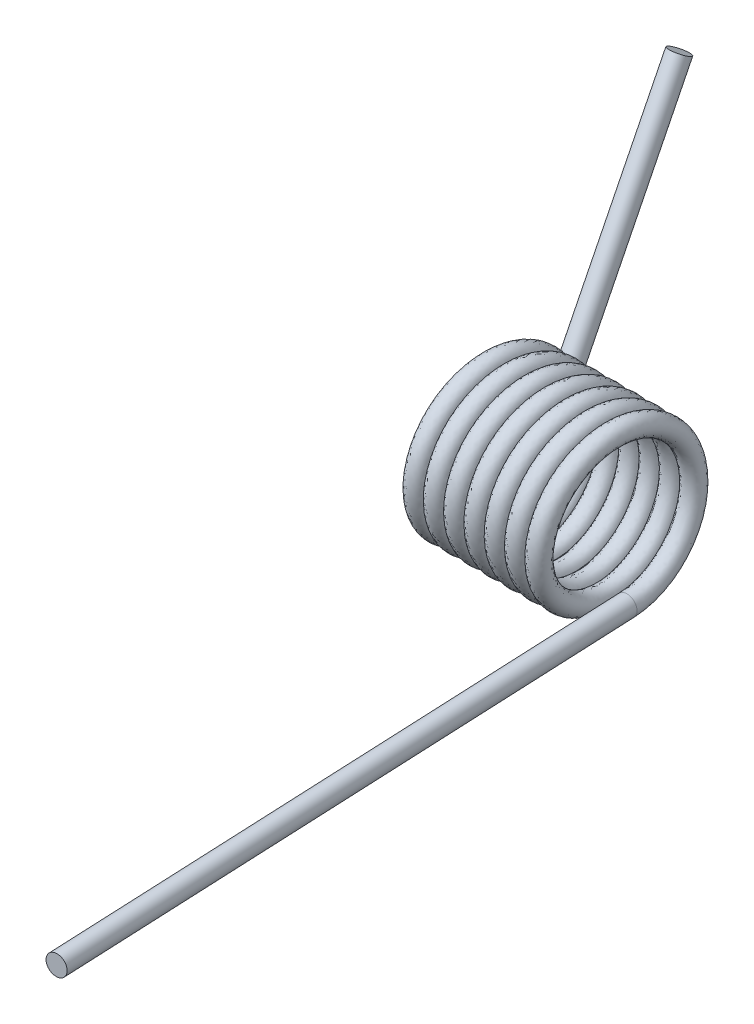
from build123d import *

# Parameters (mm, degrees)
SWEEP1_PITCH   = 3.4544
SKETCH4_R      = 1.7145
EXTRUDE1_DEPTH = 101.6
SKETCH5_R      = 1.7145
EXTRUDE2_DEPTH = 50.8


with BuildPart() as part:
    # Sweep1: the profile of Sketch3 screwed along a left-hand helix of 7.166667 turns, 6 arcs to a turn; built about Z, then put on its axis
    sweep1_z = Axis((0, 0, 0), (0, 0, 1))
    sweep1_corners = [(12.320738343, -0.07665633, -1.712322097), (13.994937093, 0.001781677, 0.039798483), (12.241061657, 0.07665633, 1.712322097), (10.566862907, -0.001781677, -0.039798483)]
    with BuildLine(mode=Mode.PRIVATE) as sweep1_profile:
        ThreePointArc((12.320738343, -0.07665633, -1.712322097), (13.521077214, -0.052944375, -1.182652789), (13.994937093, 0.001781677, 0.039798483))
        ThreePointArc((13.994937093, 0.001781677, 0.039798483), (13.464737289, 0.055464047, 1.238936343), (12.241061657, 0.07665633, 1.712322097))
        ThreePointArc((12.241061657, 0.07665633, 1.712322097), (11.040722786, 0.052944375, 1.182652789), (10.566862907, -0.001781677, -0.039798483))
        ThreePointArc((10.566862907, -0.001781677, -0.039798483), (11.097062711, -0.055464047, -1.238936343), (12.320738343, -0.07665633, -1.712322097))
    sweep1_cap = Face(sweep1_profile.wire())
    sweep1_arcs = [((12.320738343, -0.07665633, -1.712322097), (14.034775436, -0.074874653, -1.672523614), (13.994937093, 0.001781677, 0.039798483), (1, 0.7071067811865476, 1)), ((13.994937093, 0.001781677, 0.039798483), (13.95509875, 0.078438007, 1.75212058), (12.241061657, 0.07665633, 1.712322097), (1, 0.7071067811865476, 1)), ((12.241061657, 0.07665633, 1.712322097), (10.527024564, 0.074874653, 1.672523614), (10.566862907, -0.001781677, -0.039798483), (1, 0.7071067811865476, 1)), ((10.566862907, -0.001781677, -0.039798483), (10.60670125, -0.078438007, -1.75212058), (12.320738343, -0.07665633, -1.712322097), (1, 0.7071067811865476, 1))]  # start, shoulder, end, weights
    sweep1_turn_angles = [0, -30, -60, -90, -120, -150, -180, -210, -240, -270, -300, -330, -360]
    sweep1_turn_weights = [1, 0.8660254037844387, 1, 0.8660254037844387, 1, 0.8660254037844387, 1, 0.8660254037844387, 1, 0.8660254037844387, 1, 0.8660254037844387, 1]
    sweep1_turn_sides = [Face.make_bezier_surface([[Vector(p[j][0], p[j][1], 0).rotate(sweep1_z, sweep1_turn_angles[2 * i + k]) / sweep1_turn_weights[2 * i + k] + Vector(0, 0, p[j][2] + -SWEEP1_PITCH * sweep1_turn_angles[2 * i + k] / 360) for k in range(3)] for j in range(3)], [[p[3][j] * sweep1_turn_weights[2 * i + k] for k in range(3)] for j in range(3)]) for p in sweep1_arcs for i in range(6)]
    sweep1_last_angles = [-2520, -2550, -2580]
    sweep1_last_weights = [1, 0.8660254037844287, 1]
    sweep1_last_sides = [Face.make_bezier_surface([[Vector(p[j][0], p[j][1], 0).rotate(sweep1_z, sweep1_last_angles[2 * i + k]) / sweep1_last_weights[2 * i + k] + Vector(0, 0, p[j][2] + -SWEEP1_PITCH * sweep1_last_angles[2 * i + k] / 360) for k in range(3)] for j in range(3)], [[p[3][j] * sweep1_last_weights[2 * i + k] for k in range(3)] for j in range(3)]) for p in sweep1_arcs for i in range(1)]
    sweep1 = Plane(origin=(0, 0, 0), x_dir=(0, -1, 0), z_dir=(-1, 0, 0)) * Solid(Shell([*[p.moved(Location((0, 0, SWEEP1_PITCH * i))) for i in range(7) for p in sweep1_turn_sides], *sweep1_last_sides, sweep1_cap, sweep1_cap.rotate(sweep1_z, -2580).moved(Location((0, 0, -SWEEP1_PITCH * -2580 / 360)))]))
    add(sweep1)

    # Sketch4 → Extrude1 (add)
    with BuildSketch(Plane(origin=(0, 0, 0), x_dir=(-0.9987297153021847, 0.02323612909274777, 0.04471060363272435), z_dir=(0.04472267854557101, -1.0786510573623783e-14, 0.9989994404521505))):
        with Locations(Location((-0.285360578, 12.277584215, 0), (0, 0, 181.33145196))):
            Circle(SKETCH4_R)
    extrude(amount=EXTRUDE1_DEPTH)

    # Sketch5 → Extrude2 (add)
    with BuildSketch(Plane(origin=(-0.049515987, 0.957885311, -0.553035342), x_dir=(0.9989994399133585, 0.03874739722860747, -0.02233289638189968), z_dir=(-0.04472267854557102, 0.8651588937980697, -0.49949972022595795))):
        with Locations(Location((-24.732166276, 12.280087728, 0), (0, 0, 180.001881766))):
            Circle(SKETCH5_R)
    extrude(amount=EXTRUDE2_DEPTH)


solid = part.part
